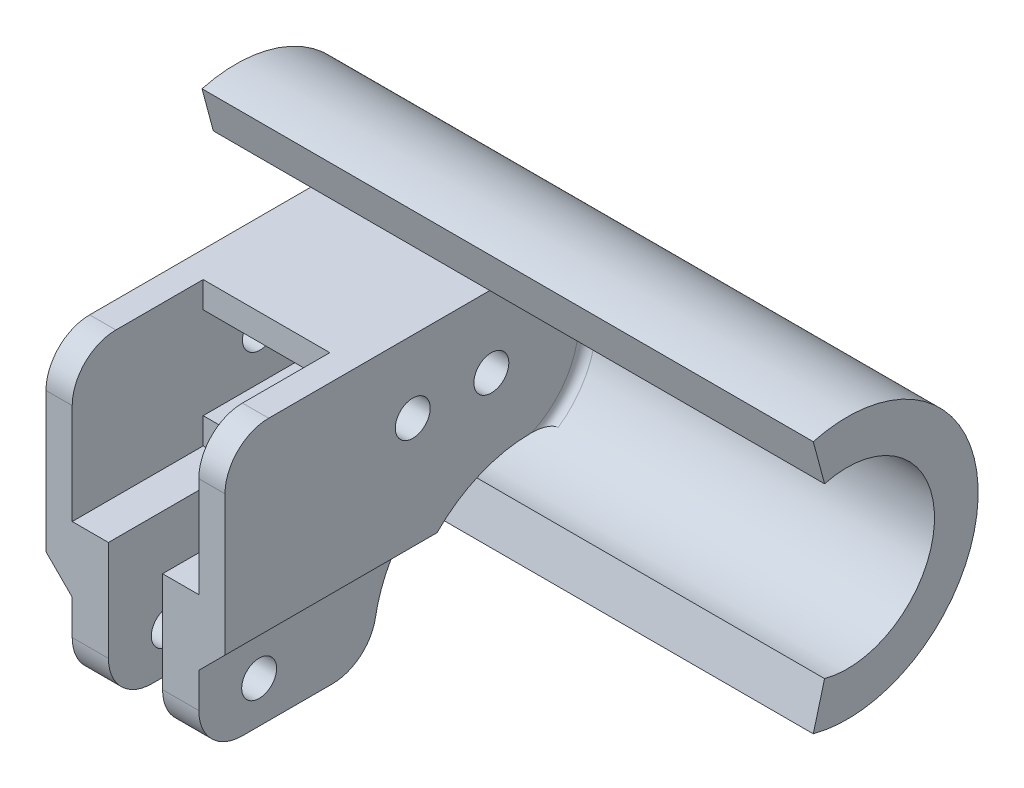
from build123d import *

# Parameters (mm, degrees)
SKETCH1_W                = 20.5
SKETCH1_H                = 16.5
SKETCH1_W_2              = 14.5
SKETCH1_H_2              = 10.5
BOSS_EXTRUDE1_DEPTH      = 41.5
SKETCH2_W                = 14.5
SKETCH2_H                = 3
CUT_EXTRUDE1_DEPTH       = 15
BOSS_EXTRUDE2_DEPTH      = 50
BOSS_EXTRUDE2_DEPTH_BACK = 20
SKETCH5_R                = 2
CUT_EXTRUDE2_DEPTH       = 25
SKETCH12_W               = 7.15
SKETCH12_H               = 20
BOSS_EXTRUDE16_DEPTH     = 16.5
SKETCH13_W               = 3
SKETCH13_H               = 20
CUT_EXTRUDE5_DEPTH       = 12
CHAMFER1_SIZE            = 3
FILLET6_R                = 15
FILLET7_R                = 5
SKETCH7_R                = 2
CUT_EXTRUDE6_DEPTH       = 78.232603305
FILLET14_R               = 1


with BuildPart() as part:
    # Sketch1 → Boss-Extrude1 (new body)
    with BuildSketch(Plane.XY):
        Rectangle(SKETCH1_W, SKETCH1_H)
        Rectangle(SKETCH1_W_2, SKETCH1_H_2, mode=Mode.SUBTRACT)
    extrude(amount=BOSS_EXTRUDE1_DEPTH)

    # Sketch2 → Cut-Extrude1 (cut)
    with BuildSketch(Plane.XY.offset(41.5)):
        with Locations((0, 6.75)):
            Rectangle(SKETCH2_W, SKETCH2_H)
        with Locations((0, -6.75)):
            Rectangle(SKETCH2_W, SKETCH2_H)
    extrude(amount=-CUT_EXTRUDE1_DEPTH, mode=Mode.SUBTRACT)

    # Sketch3 → Boss-Extrude2 (add, two sides: drawn at the far end of the back side and taken through both)
    with BuildSketch(Plane(origin=(0, 0, 0), x_dir=(0, 0, -1), z_dir=(1, 0, 0)).offset(-BOSS_EXTRUDE2_DEPTH_BACK)):
        with BuildLine():
            Line((-13.882285677, -14.488887394), (-12.588190451, -9.659258263))
            ThreePointArc((-12.588190451, -9.659258263), (0, 0), (-12.588190451, 9.659258263))
            Line((-12.588190451, 9.659258263), (-13.882285677, 14.488887394))
            ThreePointArc((-13.882285677, 14.488887394), (5, 0), (-13.882285677, -14.488887394))
        make_face()
    extrude(amount=BOSS_EXTRUDE2_DEPTH + BOSS_EXTRUDE2_DEPTH_BACK)

    # Sketch5 → Cut-Extrude2 (cut)
    with BuildSketch(Plane(origin=(10.25, 0, 0), x_dir=(0, 0, -1), z_dir=(1, 0, 0))):
        with Locations(Location((-20, 0, 0), (0, 0, 90))):
            Circle(SKETCH5_R)
        with Locations(Location((-11, 0, 0), (0, 0, 90))):
            Circle(SKETCH5_R)
    extrude(amount=-CUT_EXTRUDE2_DEPTH, mode=Mode.SUBTRACT)

    # Sketch12 → Boss-Extrude16 (add)
    with BuildSketch(Plane.XZ.offset(8.25)):
        with Locations((-6.675, 31.5)):
            Rectangle(SKETCH12_W, SKETCH12_H)
        with Locations((6.675, 31.5)):
            Rectangle(SKETCH12_W, SKETCH12_H)
    extrude(amount=BOSS_EXTRUDE16_DEPTH)

    # Sketch13 → Cut-Extrude5 (cut)
    with BuildSketch(Plane.XZ.offset(24.75)):
        with Locations((-8.75, 31.5)):
            Rectangle(SKETCH13_W, SKETCH13_H)
        with Locations((8.75, 31.5)):
            Rectangle(SKETCH13_W, SKETCH13_H)
    extrude(amount=-CUT_EXTRUDE5_DEPTH, mode=Mode.SUBTRACT)

    # Chamfer1
    chamfer1_edges = [part.edges().sort_by_distance(p)[0] for p in [
        (7.25, -12.75, 31.5),
        (-7.25, -12.75, 31.5),
    ]]
    chamfer(chamfer1_edges, length=CHAMFER1_SIZE - 0.0001)  # a hair under: the kernel refuses the full size

    # Fillet6
    fillet6_edges = [part.edges().sort_by_distance(p)[0] for p in [
        (6.675, -8.25, 21.5),
        (-6.675, -8.25, 21.5),
    ]]
    fillet(fillet6_edges, radius=FILLET6_R)

    # Fillet7
    fillet7_edges = [part.edges().sort_by_distance(p)[0] for p in [
        (8.75, 8.25, 41.5),
        (-8.75, 8.25, 41.5),
        (5.175, -24.75, 21.5),
        (5.175, -24.75, 41.5),
        (-5.175, -24.75, 41.5),
        (-5.175, -24.75, 21.5),
    ]]
    fillet(fillet7_edges, radius=FILLET7_R)

    # Sketch7 → Cut-Extrude6 (cut, through all)
    with BuildSketch(Plane.ZY.offset(10.25)):
        with Locations(Location((34.590169944, -20, 0), (0, 0, 180))):
            Circle(SKETCH7_R)
    extrude(amount=-CUT_EXTRUDE6_DEPTH, mode=Mode.SUBTRACT)

    # Fillet14
    fillet14_edges = [part.edges().sort_by_distance(p)[0] for p in [
        (10.25, 0, 0),
        (-10.25, 0, 0),
    ]]
    fillet(fillet14_edges, radius=FILLET14_R)


solid = part.part
